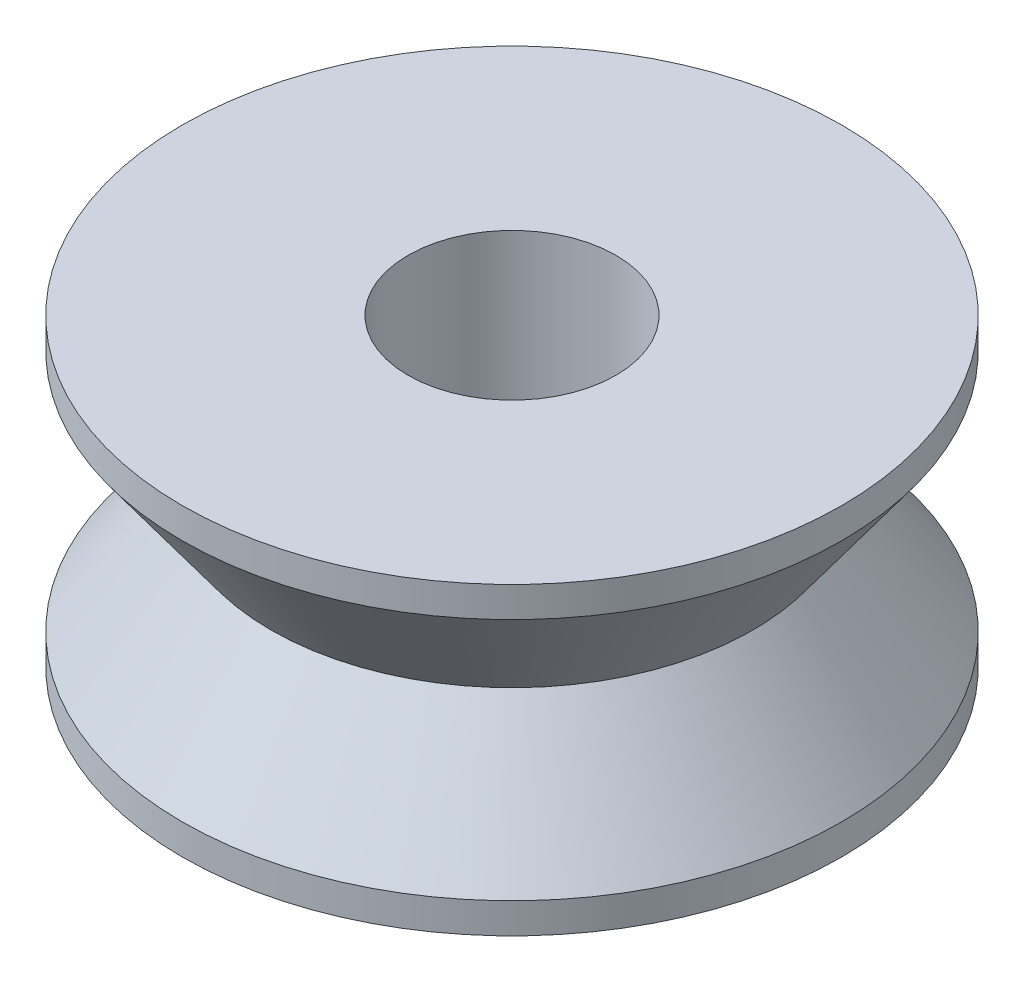
from build123d import *

# Parameters (mm, degrees)
CUT_EXTRUDE1_REACH = 12.977
SKETCH2_R          = 2.05


with BuildPart() as part:
    # Sketch1 → Revolve1 (revolve)
    with BuildSketch(Plane.XY):
        Polygon((0, 6), (6.5, 6), (6.5, 5.4), (4.75, 3), (6.5, 0.6), (6.5, 0), (0, 0), align=None)
    revolve(axis=Axis((0, 0, 0), (0, 1, 0)))

    # Sketch2 → Cut-Extrude1 (cut, up to next)
    with BuildSketch(Plane(origin=(0, 6, 0), x_dir=(1, 0, 0), z_dir=(0, 1, 0)), mode=Mode.PRIVATE) as cut_extrude1_sk1:
        Circle(SKETCH2_R)
    cut_extrude1_tool1 = extrude(cut_extrude1_sk1.sketch, amount=-CUT_EXTRUDE1_REACH, mode=Mode.PRIVATE) & part.part
    add(cut_extrude1_tool1.solids().sort_by_distance((0, 6, 0))[0], mode=Mode.SUBTRACT)


solid = part.part
